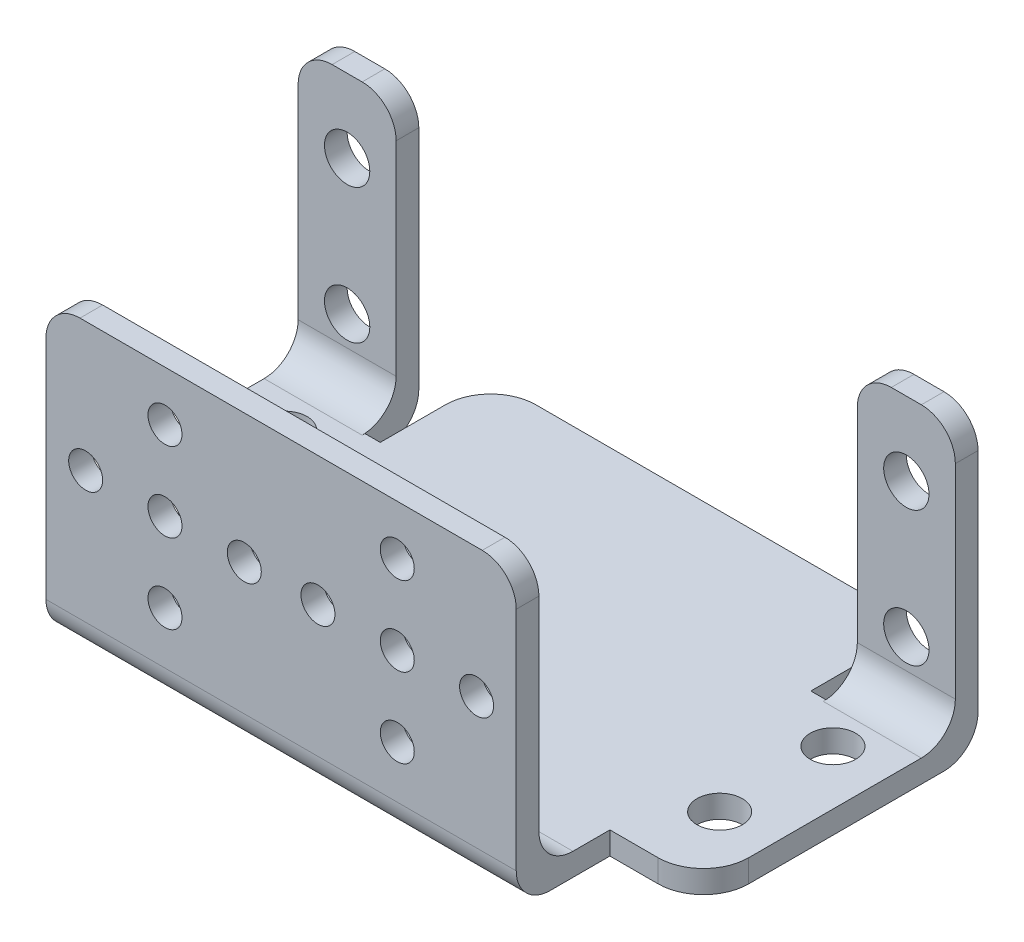
from build123d import *

# Parameters (mm, degrees)
SKETCH_1_R          = 2
EXTRUDE_1_DEPTH     = 2
SKETCH_3_W          = 8.650610314
SKETCH_3_H          = 2
SKETCH_3_W_2        = 41.5
EXTRUDE_2_DEPTH     = 26
CUT_EXTRUDE_1_REACH = 51.47
SKETCH_4_R          = 2
CUT_EXTRUDE_2_REACH = 56.06
SKETCH_5_R          = 1.5
FILLET_1_R          = 3


with BuildPart() as part:
    # 草图1 → 凸台-拉伸1 (new body)
    with BuildSketch(Plane(origin=(0, 0, 0), x_dir=(1, 0, 0), z_dir=(0, 1, 0))):
        with BuildLine():
            Line((20.75, 0), (-20.75, 0))
            Line((-20.75, 0), (-20.75, 6.26619118))
            Line((-20.75, 6.26619118), (-25, 6.26619118))
            ThreePointArc((-25, 6.26619118), (-27.828427125, 7.437764055), (-29, 10.26619118))
            Line((-29, 10.26619118), (-29, 28.5))
            Line((-29, 28.5), (-20.349389686, 28.5))
            Line((-20.349389686, 28.5), (-20.349389686, 25.746501866))
            Line((-20.349389686, 25.746501866), (-19, 25.746501866))
            Line((-19, 25.746501866), (-19, 31.49))
            ThreePointArc((-19, 31.49), (-17.828427125, 34.318427125), (-15, 35.49))
            Line((-15, 35.49), (15, 35.49))
            ThreePointArc((15, 35.49), (17.828427125, 34.318427125), (19, 31.49))
            Line((19, 31.49), (19, 25.746501866))
            Line((19, 25.746501866), (20.349389686, 25.746501866))
            Line((20.349389686, 25.746501866), (20.349389686, 28.5))
            Line((20.349389686, 28.5), (29, 28.5))
            Line((29, 28.5), (29, 10.26619118))
            ThreePointArc((29, 10.26619118), (27.828427125, 7.437764055), (25, 6.26619118))
            Line((25, 6.26619118), (20.75, 6.26619118))
            Line((20.75, 6.26619118), (20.75, 0))
        make_face()
        with Locations(Location((-24.2, 22.5, 0), (0, 0, 270))):
            Circle(SKETCH_1_R, mode=Mode.SUBTRACT)
        with Locations(Location((-24.2, 12.5, 0), (0, 0, 270))):
            Circle(SKETCH_1_R, mode=Mode.SUBTRACT)
        with Locations(Location((24.2, 12.5, 0), (0, 0, 90))):
            Circle(SKETCH_1_R, mode=Mode.SUBTRACT)
        with Locations(Location((24.2, 22.5, 0), (0, 0, 90))):
            Circle(SKETCH_1_R, mode=Mode.SUBTRACT)
    extrude(amount=EXTRUDE_1_DEPTH)

    # 草图3 → 凸台-拉伸2 (add)
    with BuildSketch(Plane(origin=(0, 0, 0), x_dir=(1, 0, 0), z_dir=(0, 1, 0))):
        with Locations((-24.674694843, 29.5)):
            Rectangle(SKETCH_3_W, SKETCH_3_H)
        with Locations((24.674694843, 29.5)):
            Rectangle(SKETCH_3_W, SKETCH_3_H)
        with Locations((0, -1)):
            Rectangle(SKETCH_3_W_2, SKETCH_3_H)
    extrude(amount=EXTRUDE_2_DEPTH)

    # 草图4 → 切除-拉伸1 (cut, up to next)
    with BuildSketch(Plane.XY.offset(-28.5), mode=Mode.PRIVATE) as cut_extrude_1_sk1:
        with Locations((-24.674694843, 19.5)):
            Circle(SKETCH_4_R)
    cut_extrude_1_tool1 = extrude(cut_extrude_1_sk1.sketch, amount=-CUT_EXTRUDE_1_REACH, mode=Mode.PRIVATE) & part.part
    # 草图4 → 切除-拉伸1 (cut, up to next)
    with BuildSketch(Plane.XY.offset(-28.5), mode=Mode.PRIVATE) as cut_extrude_1_sk2:
        with Locations((-24.674694843, 7.6)):
            Circle(SKETCH_4_R)
    cut_extrude_1_tool2 = extrude(cut_extrude_1_sk2.sketch, amount=-CUT_EXTRUDE_1_REACH, mode=Mode.PRIVATE) & part.part
    cut_extrude_1_1 = cut_extrude_1_tool1.solids().sort_by_distance((-24.674695, 19.5, -28.5))[0]
    add(cut_extrude_1_1, mode=Mode.SUBTRACT)
    cut_extrude_1_2 = cut_extrude_1_tool2.solids().sort_by_distance((-24.674695, 7.6, -28.5))[0]
    add(cut_extrude_1_2, mode=Mode.SUBTRACT)
    cut_extrude_1 = cut_extrude_1_1 + cut_extrude_1_2  # 切除-拉伸1 as one shape, for the pattern or mirror that repeats it

    # 草图5 → 切除-拉伸2 (cut, up to next)
    with BuildSketch(Plane.XY.offset(2), mode=Mode.PRIVATE) as cut_extrude_2_sk1:
        with Locations((-10.25, 14.6)):
            Circle(SKETCH_5_R)
    cut_extrude_2_tool1 = extrude(cut_extrude_2_sk1.sketch, amount=-CUT_EXTRUDE_2_REACH, mode=Mode.PRIVATE) & part.part
    # 草图5 → 切除-拉伸2 (cut, up to next)
    with BuildSketch(Plane.XY.offset(2), mode=Mode.PRIVATE) as cut_extrude_2_sk2:
        with Locations((-10.25, 21.6)):
            Circle(SKETCH_5_R)
    cut_extrude_2_tool2 = extrude(cut_extrude_2_sk2.sketch, amount=-CUT_EXTRUDE_2_REACH, mode=Mode.PRIVATE) & part.part
    # 草图5 → 切除-拉伸2 (cut, up to next)
    with BuildSketch(Plane.XY.offset(2), mode=Mode.PRIVATE) as cut_extrude_2_sk3:
        with Locations((-3.25, 14.6)):
            Circle(SKETCH_5_R)
    cut_extrude_2_tool3 = extrude(cut_extrude_2_sk3.sketch, amount=-CUT_EXTRUDE_2_REACH, mode=Mode.PRIVATE) & part.part
    # 草图5 → 切除-拉伸2 (cut, up to next)
    with BuildSketch(Plane.XY.offset(2), mode=Mode.PRIVATE) as cut_extrude_2_sk4:
        with Locations((-10.25, 7.6)):
            Circle(SKETCH_5_R)
    cut_extrude_2_tool4 = extrude(cut_extrude_2_sk4.sketch, amount=-CUT_EXTRUDE_2_REACH, mode=Mode.PRIVATE) & part.part
    # 草图5 → 切除-拉伸2 (cut, up to next)
    with BuildSketch(Plane.XY.offset(2), mode=Mode.PRIVATE) as cut_extrude_2_sk5:
        with Locations((-17.25, 14.6)):
            Circle(SKETCH_5_R)
    cut_extrude_2_tool5 = extrude(cut_extrude_2_sk5.sketch, amount=-CUT_EXTRUDE_2_REACH, mode=Mode.PRIVATE) & part.part
    cut_extrude_2_1 = cut_extrude_2_tool1.solids().sort_by_distance((-10.25, 14.6, 2))[0]
    add(cut_extrude_2_1, mode=Mode.SUBTRACT)
    cut_extrude_2_2 = cut_extrude_2_tool2.solids().sort_by_distance((-10.25, 21.6, 2))[0]
    add(cut_extrude_2_2, mode=Mode.SUBTRACT)
    cut_extrude_2_3 = cut_extrude_2_tool3.solids().sort_by_distance((-3.25, 14.6, 2))[0]
    add(cut_extrude_2_3, mode=Mode.SUBTRACT)
    cut_extrude_2_4 = cut_extrude_2_tool4.solids().sort_by_distance((-10.25, 7.6, 2))[0]
    add(cut_extrude_2_4, mode=Mode.SUBTRACT)
    cut_extrude_2_5 = cut_extrude_2_tool5.solids().sort_by_distance((-17.25, 14.6, 2))[0]
    add(cut_extrude_2_5, mode=Mode.SUBTRACT)
    cut_extrude_2 = cut_extrude_2_1 + cut_extrude_2_2 + cut_extrude_2_3 + cut_extrude_2_4 + cut_extrude_2_5  # 切除-拉伸2 as one shape, for the pattern or mirror that repeats it

    # 镜向2: 切除-拉伸1, 切除-拉伸2 across plane
    add(cut_extrude_1.mirror(Plane.ZY), mode=Mode.SUBTRACT)
    add(cut_extrude_2.mirror(Plane.ZY), mode=Mode.SUBTRACT)

    # 圆角1
    # the kernel refuses this fillet: 3 mm, written as the material it adds along each edge
    with BuildSketch(Plane(origin=(20.349389686, 2, -28.5), x_dir=(0, 0, 1), z_dir=(1, 0, 0)), Plane(origin=(-29, 2, -28.5), x_dir=(0, 0, 1), z_dir=(1, 0, 0))) as fillet_1_piece_1:
        with BuildLine():
            CenterArc((FILLET_1_R, -FILLET_1_R), FILLET_1_R, 90, 90)
            Line((0, -FILLET_1_R), (0, 0))
            Line((0, 0), (FILLET_1_R, 0))
        make_face()
    extrude(amount=8.650610314)
    with BuildSketch(Plane(origin=(20.75, 2, 0), x_dir=(0, 0, -1), z_dir=(-1, 0, 0))) as fillet_1_piece_2:
        with BuildLine():
            CenterArc((FILLET_1_R, -FILLET_1_R), FILLET_1_R, 90, 90)
            Line((0, -FILLET_1_R), (0, 0))
            Line((0, 0), (FILLET_1_R, 0))
        make_face()
    extrude(amount=41.5)
    # the kernel refuses this fillet: 3 mm, written as the material it takes off along each edge
    with BuildSketch(Plane(origin=(-12.849389686, 0, -30.5), x_dir=(0, 0, 1), z_dir=(-1, 0, 0))) as fillet_1_2_piece_1_section:
        with BuildLine():
            CenterArc((FILLET_1_R, FILLET_1_R), FILLET_1_R, 180, 90)
            Line((0, FILLET_1_R), (0, 0))
            Line((0, 0), (FILLET_1_R, 0))
        make_face()
    fillet_1_2_piece_1 = extrude(amount=23.650610314, mode=Mode.PRIVATE)
    fillet_1_2_piece_1 = split(fillet_1_2_piece_1, bisect_by=Plane(origin=(-19, 0.622520274, -29.811239081), z_dir=(-1, 0, 0)), keep=Keep.TOP, mode=Mode.PRIVATE)
    add(fillet_1_2_piece_1, mode=Mode.SUBTRACT)
    with BuildSketch(Plane(origin=(-29, 26, -38), x_dir=(0, -1, 0), z_dir=(0, 0, 1)), Plane(origin=(-20.349389686, 26, -21), x_dir=(0, -1, 0), z_dir=(0, 0, -1)), Plane(origin=(20.349389686, 26, -38), x_dir=(0, -1, 0), z_dir=(0, 0, 1)), Plane(origin=(29, 26, -21), x_dir=(0, -1, 0), z_dir=(0, 0, -1)), Plane(origin=(-20.75, 26, 9.5), x_dir=(1, 0, 0), z_dir=(0, 0, -1))) as fillet_1_2_piece_2:
        with BuildLine():
            CenterArc((FILLET_1_R, FILLET_1_R), FILLET_1_R, 180, 90)
            Line((0, FILLET_1_R), (0, 0))
            Line((0, 0), (FILLET_1_R, 0))
        make_face()
    extrude(amount=17, mode=Mode.SUBTRACT)
    with BuildSketch(Plane(origin=(36.5, 0, -30.5), x_dir=(0, 0, 1), z_dir=(-1, 0, 0))) as fillet_1_2_piece_3:
        with BuildLine():
            CenterArc((FILLET_1_R, FILLET_1_R), FILLET_1_R, 180, 90)
            Line((0, FILLET_1_R), (0, 0))
            Line((0, 0), (FILLET_1_R, 0))
        make_face()
    extrude(amount=16.150610314, mode=Mode.SUBTRACT)
    with BuildSketch(Plane(origin=(28.25, 0, 2), x_dir=(0, 0, -1), z_dir=(-1, 0, 0))) as fillet_1_2_piece_4:
        with BuildLine():
            CenterArc((FILLET_1_R, -FILLET_1_R), FILLET_1_R, 90, 90)
            Line((0, -FILLET_1_R), (0, 0))
            Line((0, 0), (FILLET_1_R, 0))
        make_face()
    extrude(amount=56.5, mode=Mode.SUBTRACT)
    with BuildSketch(Plane(origin=(20.75, 26, -7.5), x_dir=(0, -1, 0), z_dir=(0, 0, 1))) as fillet_1_2_piece_5:
        with BuildLine():
            CenterArc((FILLET_1_R, -FILLET_1_R), FILLET_1_R, 90, 90)
            Line((0, -FILLET_1_R), (0, 0))
            Line((0, 0), (FILLET_1_R, 0))
        make_face()
    extrude(amount=17, mode=Mode.SUBTRACT)


solid = part.part
